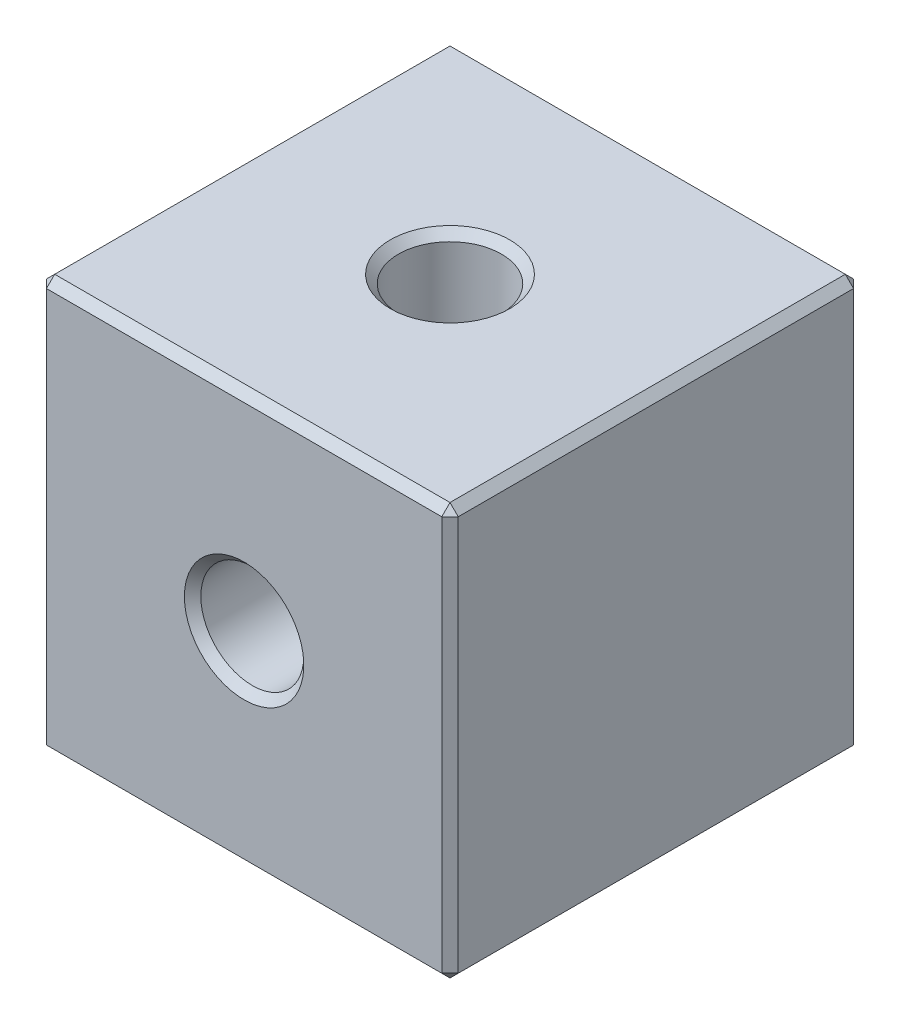
from build123d import *
from OCP.BRepAlgoAPI import BRepAlgoAPI_Cut
from OCP.TopTools import TopTools_ListOfShape

# Parameters (mm, degrees)
SKETCH_1_W                 = 10
SKETCH_1_H                 = 10
EXTRUDE_1_DEPTH            = 5
HOLE_WIZARD_M3_1_D         = 2.5
HOLE_WIZARD_M3_1_DEPTH     = 4.999
HOLE_WIZARD_M3_2_OUTLINE_R = 1.25
HOLE_WIZARD_M3_2_DEPTH     = 5
HOLE_START                 = -5
HOLE_WIZARD_M3_3_OUTLINE_R = 1.25
HOLE_WIZARD_M3_3_DEPTH     = 5
CHAMFER_1_SIZE             = 0.2


with BuildPart() as part:
    # 草图1 → 凸台-拉伸1 (new, symmetric)
    with BuildSketch(Plane(origin=(0, 0, 0), x_dir=(1, 0, 0), z_dir=(0, 1, 0))):
        Rectangle(SKETCH_1_W, SKETCH_1_H)
    extrude(amount=EXTRUDE_1_DEPTH, both=True)

    # M3 螺纹孔1
    with Locations(Plane.XY.offset(5)):
        with Locations((0, 0)):
            Hole(HOLE_WIZARD_M3_1_D / 2, depth=HOLE_WIZARD_M3_1_DEPTH)


with BuildPart() as hole_wizard_m3_2_tool:
    # M3 螺纹孔2: read off the stored shape, not the designer's step
    # M3 螺纹孔2 outline → M3 螺纹孔2 (new body)
    with BuildSketch(Plane(origin=(0, 0, 0), x_dir=(1, 0, 0), z_dir=(0, 1, 0))):
        Circle(HOLE_WIZARD_M3_2_OUTLINE_R)
    extrude(amount=HOLE_WIZARD_M3_2_DEPTH)


with BuildPart() as part_1:
    add(part.part)

    # M3 螺纹孔2: cut by hole_wizard_m3_2_tool, with a tolerance
    hole_wizard_m3_2_stock = TopTools_ListOfShape()
    hole_wizard_m3_2_stock.Append(part_1.part.wrapped)
    hole_wizard_m3_2_tools = TopTools_ListOfShape()
    hole_wizard_m3_2_tools.Append(hole_wizard_m3_2_tool.part.wrapped)
    hole_wizard_m3_2_cut = BRepAlgoAPI_Cut()
    hole_wizard_m3_2_cut.SetArguments(hole_wizard_m3_2_stock)
    hole_wizard_m3_2_cut.SetTools(hole_wizard_m3_2_tools)
    hole_wizard_m3_2_cut.SetFuzzyValue(0.00001)
    hole_wizard_m3_2_cut.Build()
    add(Compound.cast(hole_wizard_m3_2_cut.Shape()).solids(), mode=Mode.REPLACE)

    # M3 螺纹孔3: read off the stored shape, not the designer's step
    # M3 螺纹孔3 outline → M3 螺纹孔3 (cut)
    with BuildSketch(Plane.YZ.offset(HOLE_START)):
        Circle(HOLE_WIZARD_M3_3_OUTLINE_R)
    extrude(amount=HOLE_WIZARD_M3_3_DEPTH, mode=Mode.SUBTRACT)

    # 草图7 → 切除-旋转1 (revolve, cut)
    with BuildSketch(Plane(origin=(0, 0, 0), x_dir=(1, 0, 0), z_dir=(0, 1, 0))):
        with BuildLine():
            Line((-1.25, 0), (1.25, 0))
            ThreePointArc((1.25, 0), (0, 1.25), (-1.25, 0))
        make_face()
    revolve(axis=Axis((0, 0, 0), (-1, 0, 0)), mode=Mode.SUBTRACT)

    # 倒角1
    chamfer_1_edges = [part_1.edges().sort_by_distance(p)[0] for p in [
        (-5, 5, 0),
        (1.25, 0, 5),
        (0, 5, 5),
        (-1.25, 5, 0),
        (-5, -1.25, 0),
        (5, 5, 0),
        (0, -5, 5),
        (-5, -5, 0),
        (0, -5, -5),
        (5, -5, 0),
        (5, 0, 5),
        (-5, 0, 5),
        (-5, 0, -5),
        (5, 0, -5),
        (0, 5, -5),
    ]]
    chamfer(chamfer_1_edges, length=CHAMFER_1_SIZE)


solid = part_1.part
